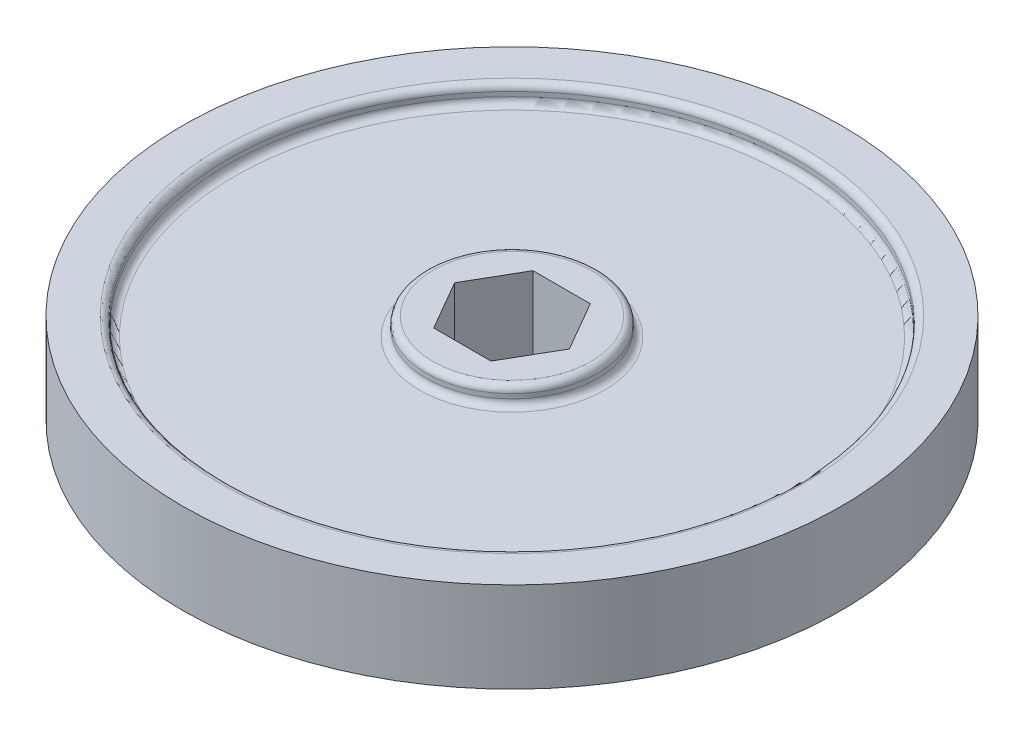
from build123d import *

# Parameters (mm, degrees)
SCHIZZO1_W                   = 36.5
SCHIZZO1_H                   = 10
FORO_6_3_6_3_1_D             = 63
FORO_6_3_6_3_1_DEPTH         = 2
SCHIZZO4_R                   = 9.5
ESTRUSIONE_ESTRUSIONE1_DEPTH = 2
FORO_6_3_6_3_2_D             = 63
FORO_6_3_6_3_2_DEPTH         = 2
ESTRUSIONE_ESTRUSIONE2_START = 2
SCHIZZO7_R                   = 9.5
ESTRUSIONE_ESTRUSIONE2_DEPTH = 2
TAGLIO_ESTRUSIONE1_DEPTH     = 53.578512721
RACCORDO1_R                  = 0.75


with BuildPart() as part:
    # Schizzo1 → Rivoluzione1 (revolve)
    with BuildSketch(Plane(origin=(0, 0, 0), x_dir=(-1, 0, 0), z_dir=(0, 0, -1))):
        with Locations((-18.25, 0)):
            Rectangle(SCHIZZO1_W, SCHIZZO1_H)
    revolve(axis=Axis((0, -5, 0), (0, 1, 0)))

    # Foro Ø6.3 (6.3)-1
    with Locations(Plane(origin=(0, -5, 0), x_dir=(-1, 0, 0), z_dir=(0, -1, 0))):
        with Locations((0, 0)):
            Hole(FORO_6_3_6_3_1_D / 2, depth=FORO_6_3_6_3_1_DEPTH)

    # Schizzo4 → Estrusione-Estrusione1 (add)
    with BuildSketch(Plane.XZ.offset(3)):
        Circle(SCHIZZO4_R)
    extrude(amount=ESTRUSIONE_ESTRUSIONE1_DEPTH)

    # Foro Ø6.3 (6.3)-2
    with Locations(Plane(origin=(0, 5, 0), x_dir=(1, 0, 0), z_dir=(0, 1, 0))):
        with Locations((0, 0)):
            Hole(FORO_6_3_6_3_2_D / 2, depth=FORO_6_3_6_3_2_DEPTH)

    # Schizzo7 → Estrusione-Estrusione2 (add)
    with BuildSketch(Plane(origin=(0, 3, 0), x_dir=(-1, 0, 0), z_dir=(0, 1, 0)).offset(ESTRUSIONE_ESTRUSIONE2_START)):
        Circle(SCHIZZO7_R)
    extrude(amount=-ESTRUSIONE_ESTRUSIONE2_DEPTH)

    # Schizzo8 → Taglio-Estrusione1 (cut, through all)
    with BuildSketch(Plane(origin=(0, 5, 0), x_dir=(-1, 0, 0), z_dir=(0, 1, 0))):
        Polygon((-3.175, -5.499261314), (3.175, -5.499261314), (6.35, 0), (3.175, 5.499261314), (-3.175, 5.499261314), (-6.35, 0), align=None)
    extrude(amount=-TAGLIO_ESTRUSIONE1_DEPTH, mode=Mode.SUBTRACT)

    # Raccordo1
    raccordo1_edges = [part.edges().sort_by_distance(p)[0] for p in [
        (31.5, 3, 0),
        (9.5, 3, 0),
        (31.5, 5, 0),
        (-9.5, -3, 0),
        (9.5, 5, 0),
        (-9.5, -5, 0),
        (-31.5, -5, 0),
        (-31.5, -3, 0),
    ]]
    fillet(raccordo1_edges, radius=RACCORDO1_R)


solid = part.part
